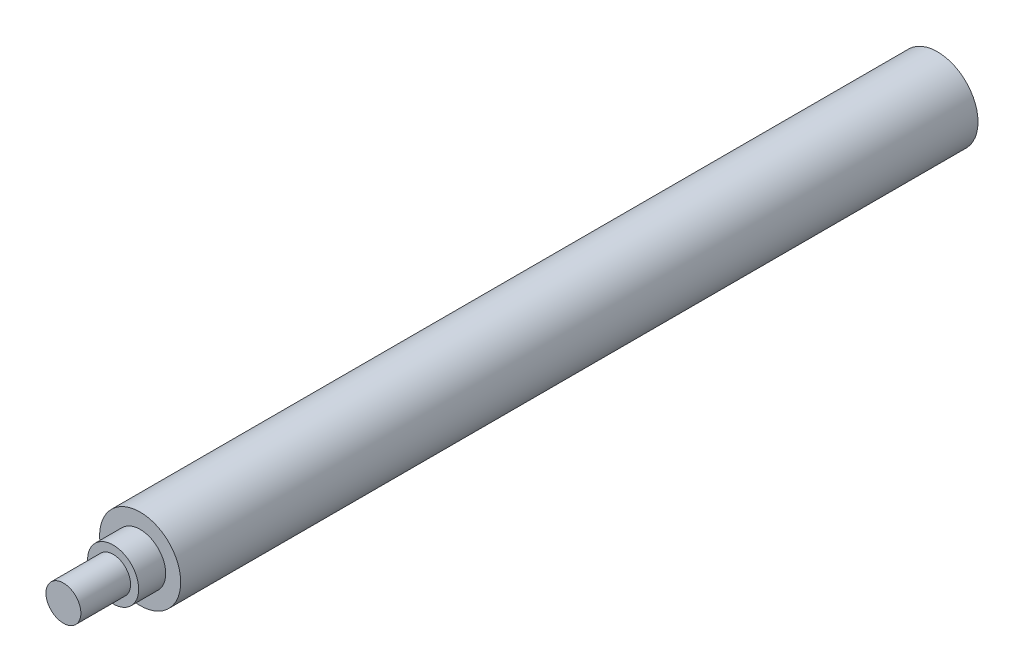
from build123d import *


with BuildPart() as part:
    # Sketch1 → Revolve1 (revolve)
    with BuildSketch(Plane(origin=(0, 0, 0), x_dir=(1, 0, 0), z_dir=(0, 1, 0))):
        Polygon((4.7625, 92.075), (0, 92.075), (0, -10.6045), (2.05, -10.6045), (2.05, -4.7625), (3, -4.7625), (3, -1.5875), (4.7625, -1.5875), align=None)
    revolve(axis=Axis((0, 0, 10.6045), (0, 0, -1)))


solid = part.part
